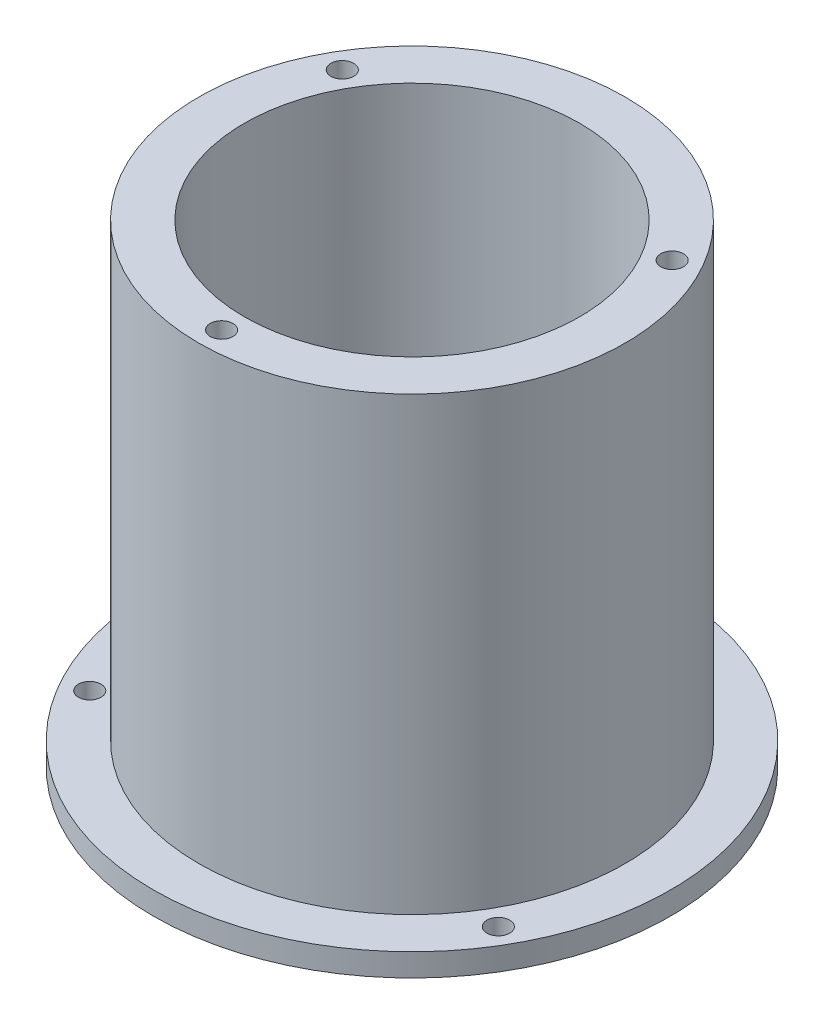
from build123d import *

# Parameters (mm, degrees)
SKETCH1_R           = 45.5
SKETCH1_R_2         = 29.5
BOSS_EXTRUDE1_DEPTH = 4
SKETCH2_R           = 37.5
SKETCH2_R_2         = 29.5
BOSS_EXTRUDE2_DEPTH = 79.3
SKETCH4_R           = 2
CUT_EXTRUDE1_DEPTH  = 83.3
CIRPATTERN1_COUNT   = 3
SKETCH6_R           = 2
CUT_EXTRUDE2_DEPTH  = 6
CIRPATTERN2_COUNT   = 3
SKETCH8_R           = 30.5
CUT_EXTRUDE4_DEPTH  = 6


with BuildPart() as part:
    # Sketch1 → Boss-Extrude1 (new body)
    with BuildSketch(Plane(origin=(0, 0, 0), x_dir=(1, 0, 0), z_dir=(0, 1, 0))):
        Circle(SKETCH1_R)
        Circle(SKETCH1_R_2, mode=Mode.SUBTRACT)
    extrude(amount=BOSS_EXTRUDE1_DEPTH)

    # Sketch2 → Boss-Extrude2 (add)
    with BuildSketch(Plane(origin=(0, 4, 0), x_dir=(1, 0, 0), z_dir=(0, 1, 0))):
        Circle(SKETCH2_R)
        Circle(SKETCH2_R_2, mode=Mode.SUBTRACT)
    extrude(amount=BOSS_EXTRUDE2_DEPTH)

    # Sketch4 → Cut-Extrude1 (cut)
    with BuildSketch(Plane(origin=(0, 4, 0), x_dir=(1, 0, 0), z_dir=(0, 1, 0))):
        with Locations((0, 41.5)):
            Circle(SKETCH4_R)
    cut_extrude1 = extrude(amount=-CUT_EXTRUDE1_DEPTH, mode=Mode.SUBTRACT)

    # CirPattern1: Cut-Extrude1 ×3 about axis
    cirpattern1_axis = Axis((0, 4, 0), (0, 1, 0))
    for i in range(1, CIRPATTERN1_COUNT):
        add(cut_extrude1.rotate(cirpattern1_axis, i * 360 / CIRPATTERN1_COUNT), mode=Mode.SUBTRACT)

    # Sketch6 → Cut-Extrude2 (cut)
    with BuildSketch(Plane(origin=(0, 83.3, 0), x_dir=(1, 0, 0), z_dir=(0, 1, 0))):
        with Locations((-29.011851027, 16.75)):
            Circle(SKETCH6_R)
    cut_extrude2 = extrude(amount=-CUT_EXTRUDE2_DEPTH, mode=Mode.SUBTRACT)

    # CirPattern2: Cut-Extrude2 ×3 about axis
    cirpattern2_axis = Axis((0, 83.3, 0), (0, 1, 0))
    for i in range(1, CIRPATTERN2_COUNT):
        add(cut_extrude2.rotate(cirpattern2_axis, i * 360 / CIRPATTERN2_COUNT), mode=Mode.SUBTRACT)

    # Sketch8 → Cut-Extrude4 (cut)
    with BuildSketch(Plane.XZ):
        Circle(SKETCH8_R)
    extrude(amount=-CUT_EXTRUDE4_DEPTH, mode=Mode.SUBTRACT)


solid = part.part
